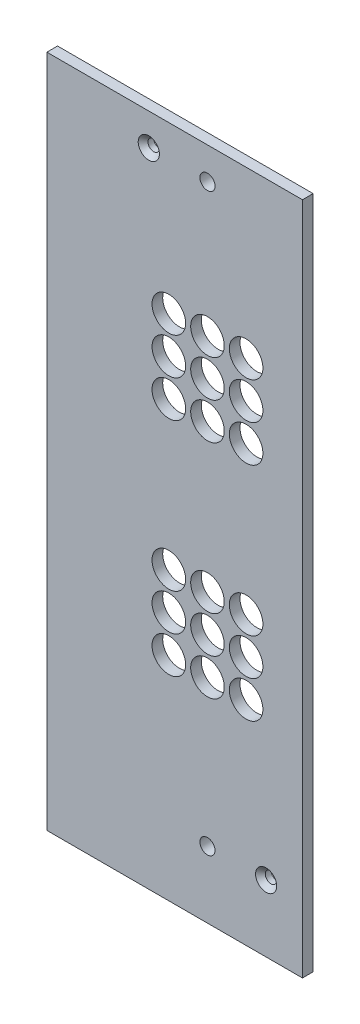
from build123d import *

# Parameters (mm, degrees)
SKETCH1_W                                       = 56.55
SKETCH1_H                                       = 197.425
BOSS_EXTRUDE1_DEPTH                             = 3.175
SKETCH2_R                                       = 5
CUT_EXTRUDE1_DEPTH                              = 103.731270343
SKETCH5_W                                       = 3.175
SKETCH5_H                                       = 197.425
BOSS_EXTRUDE2_DEPTH                             = 19.525
SKETCH14_W                                      = 76.075
SKETCH14_H                                      = 3.175
BOSS_EXTRUDE3_DEPTH                             = 3.175
M4_CLEARANCE_HOLE1_D                            = 4.5
CSK_FOR_M3_FLAT_HEAD_MACHINE_SCREW1_D           = 3.4
CSK_FOR_M3_FLAT_HEAD_MACHINE_SCREW1_CSINK_D     = 6.3
CSK_FOR_M3_FLAT_HEAD_MACHINE_SCREW1_CSINK_ANGLE = 90


with BuildPart() as part:
    # Sketch1 → Boss-Extrude1 (new body)
    with BuildSketch(Plane.XY):
        Rectangle(SKETCH1_W, SKETCH1_H)
    extrude(amount=BOSS_EXTRUDE1_DEPTH)

    # Sketch2 → Cut-Extrude1 (cut, through all)
    with BuildSketch(Plane(origin=(0, 0, 0), x_dir=(-1, 0, 0), z_dir=(0, 0, -1))):
        with Locations((-11.5, 30.630837161)):
            Circle(SKETCH2_R)
        with Locations((-11.5, 52.630837161)):
            Circle(SKETCH2_R)
        with Locations((-11.5, 41.630837161)):
            Circle(SKETCH2_R)
        with Locations((0, 52.630837161)):
            Circle(SKETCH2_R)
        with Locations((0, 41.630837161)):
            Circle(SKETCH2_R)
        with Locations((0, 30.630837161)):
            Circle(SKETCH2_R)
        with Locations((11.5, 30.630837161)):
            Circle(SKETCH2_R)
        with Locations((11.5, 41.630837161)):
            Circle(SKETCH2_R)
        with Locations((11.5, 52.630837161)):
            Circle(SKETCH2_R)
        with Locations((-11.5, -35.369162839)):
            Circle(SKETCH2_R)
        with Locations((-11.5, -13.369162839)):
            Circle(SKETCH2_R)
        with Locations((-11.5, -24.369162839)):
            Circle(SKETCH2_R)
        with Locations((0, -13.369162839)):
            Circle(SKETCH2_R)
        with Locations((0, -24.369162839)):
            Circle(SKETCH2_R)
        with Locations((0, -35.369162839)):
            Circle(SKETCH2_R)
        with Locations((11.5, -35.369162839)):
            Circle(SKETCH2_R)
        with Locations((11.5, -13.369162839)):
            Circle(SKETCH2_R)
        with Locations((11.5, -24.369162839)):
            Circle(SKETCH2_R)
    extrude(amount=-CUT_EXTRUDE1_DEPTH, mode=Mode.SUBTRACT)

    # Sketch5 → Boss-Extrude2 (add)
    with BuildSketch(Plane.ZY.offset(28.275)):
        with Locations((1.5875, 0)):
            Rectangle(SKETCH5_W, SKETCH5_H)
    extrude(amount=BOSS_EXTRUDE2_DEPTH)

    # Sketch14 → Boss-Extrude3 (add)
    with BuildSketch(Plane(origin=(0, 98.7125, 0), x_dir=(1, 0, 0), z_dir=(0, 1, 0))):
        with Locations((-9.7625, -1.5875)):
            Rectangle(SKETCH14_W, SKETCH14_H)
    extrude(amount=BOSS_EXTRUDE3_DEPTH)

    # M4 Clearance Hole1 (through all)
    with Locations(Plane.XY.offset(3.175)):
        with Locations((0, 92.3625001), (0, -78.8874999)):
            Hole(M4_CLEARANCE_HOLE1_D / 2)

    # CSK for M3 Flat Head Machine Screw1 (through all)
    with Locations(Plane.XY.offset(3.175)):
        with Locations((17.4625, -78.8874999), (-17.4625, 92.3625001)):
            CounterSinkHole(CSK_FOR_M3_FLAT_HEAD_MACHINE_SCREW1_D / 2, CSK_FOR_M3_FLAT_HEAD_MACHINE_SCREW1_CSINK_D / 2, counter_sink_angle=CSK_FOR_M3_FLAT_HEAD_MACHINE_SCREW1_CSINK_ANGLE)


solid = part.part
